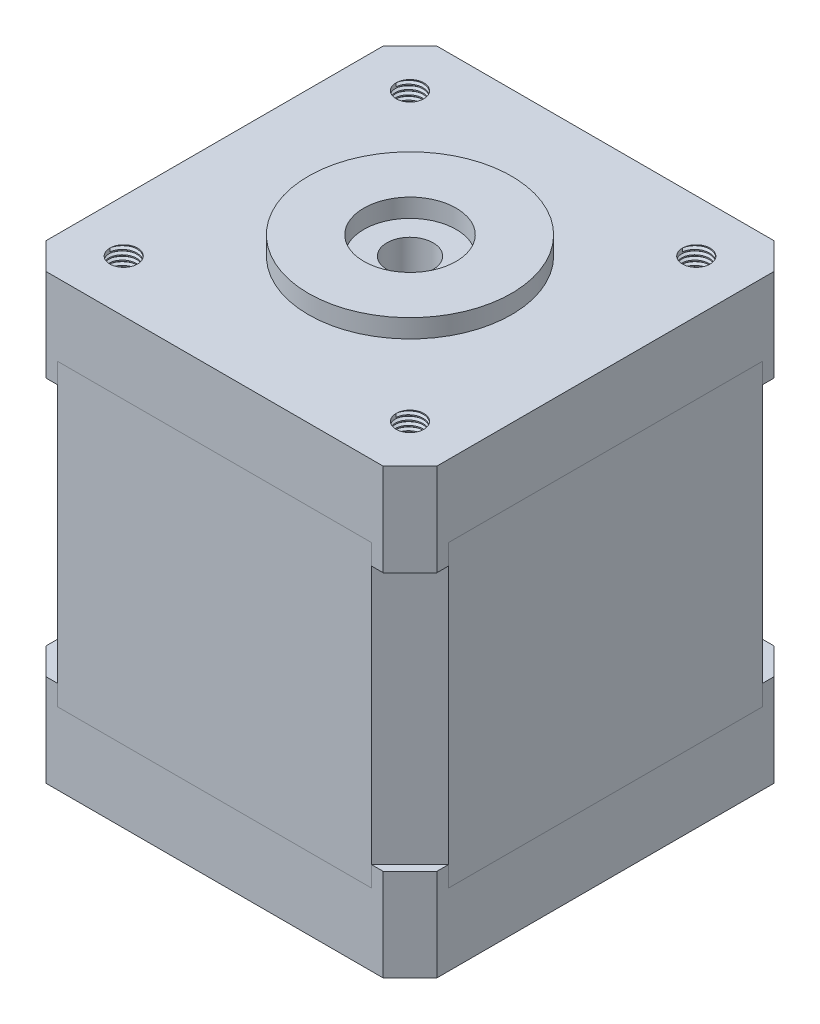
from build123d import *
from build123d.topology import SkipClean

# Parameters (mm, degrees)
BOSS_EXTRUDE1_DEPTH      = 10
CUT_EXTRUDE1_DEPTH       = 2.2
BOSS_EXTRUDE4_DEPTH      = 10
CUT_EXTRUDE2_DEPTH       = 2.2
BOSS_EXTRUDE5_DEPTH      = 30.2
BOSS_EXTRUDE5_DEPTH_BACK = 2.2
SKETCH8_R                = 10.9982
BOSS_EXTRUDE6_DEPTH      = 2
CUT_EXTRUDE3_START       = -50
SKETCH9_R                = 2.5
CUT_EXTRUDE3_DEPTH       = 50
SKETCH10_R               = 5
CUT_EXTRUDE4_DEPTH       = 2
SKETCH11_R               = 5
CUT_EXTRUDE5_DEPTH       = 2
SKETCH12_R               = 1.5
CUT_EXTRUDE6_DEPTH       = 4.5
THREAD1_PITCH            = 0.5
LPATTERN1_COUNT          = 2
LPATTERN1_PITCH          = 31
LPATTERN1_COUNT_DIR2     = 2
LPATTERN1_PITCH_DIR2     = 31
SKETCH13_R               = 1.5
CUT_EXTRUDE7_DEPTH       = 4.5
CHAMFER1_SIZE            = 0.5


with BuildPart() as part:
    # Sketch1 → Boss-Extrude1 (new body)
    with BuildSketch(Plane(origin=(0, 0, 0), x_dir=(1, 0, 0), z_dir=(0, 1, 0))):
        Polygon((-21.15, 18.25), (-18.25, 21.15), (18.25, 21.15), (21.15, 18.25), (21.15, -18.25), (18.25, -21.15), (-18.25, -21.15), (-21.15, -18.25), align=None)
    extrude(amount=BOSS_EXTRUDE1_DEPTH)

    # Sketch2 → Cut-Extrude1 (cut)
    with BuildSketch(Plane(origin=(0, 10, 0), x_dir=(1, 0, 0), z_dir=(0, 1, 0))):
        Polygon((-17, -21.15), (17, -21.15), (21.15, -17), (21.15, 17), (17, 21.15), (-17, 21.15), (-21.15, 17), (-21.15, -17), align=None)
    extrude(amount=-CUT_EXTRUDE1_DEPTH, mode=Mode.SUBTRACT)


with BuildPart() as body_2:
    # Sketch6 → Boss-Extrude4 (new body)
    with BuildSketch(Plane(origin=(0, 48, 0), x_dir=(-1, 0, 0), z_dir=(0, -1, 0))):
        Polygon((21.15, -18.25), (21.15, 18.25), (18.25, 21.15), (-18.25, 21.15), (-21.15, 18.25), (-21.15, -18.25), (-18.25, -21.15), (18.25, -21.15), align=None)
    extrude(amount=BOSS_EXTRUDE4_DEPTH)

    # Sketch7 → Cut-Extrude2 (cut)
    with BuildSketch(Plane.XZ.offset(-38)):
        Polygon((17, -21.15), (21.15, -17), (21.15, 17), (17, 21.15), (-17, 21.15), (-21.15, 17), (-21.15, -17), (-17, -21.15), align=None)
    extrude(amount=-CUT_EXTRUDE2_DEPTH, mode=Mode.SUBTRACT)

    # Sketch8 → Boss-Extrude6 (add)
    with BuildSketch(Plane(origin=(0, 48, 0), x_dir=(1, 0, 0), z_dir=(0, 1, 0))):
        with Locations(Location((0, 0, 0), (0, 0, 270))):
            Circle(SKETCH8_R)
    extrude(amount=BOSS_EXTRUDE6_DEPTH)


with BuildPart() as body_3:
    # Sketch2<2> → Boss-Extrude5 (new, two sides: drawn at the far end of the back side and taken through both)
    with BuildSketch(Plane(origin=(0, 10, 0), x_dir=(1, 0, 0), z_dir=(0, 1, 0)).offset(-BOSS_EXTRUDE5_DEPTH_BACK)):
        Polygon((-17, -21.15), (17, -21.15), (21.15, -17), (21.15, 17), (17, 21.15), (-17, 21.15), (-21.15, 17), (-21.15, -17), align=None)
    extrude(amount=BOSS_EXTRUDE5_DEPTH + BOSS_EXTRUDE5_DEPTH_BACK)


with BuildPart() as cut_extrude3_tool:
    # Sketch9 → Cut-Extrude3 (new body)
    with BuildSketch(Plane(origin=(0, 50, 0), x_dir=(1, 0, 0), z_dir=(0, 1, 0)).offset(CUT_EXTRUDE3_START)):
        with Locations(Location((0, 0, 0), (0, 0, 270))):
            Circle(SKETCH9_R)
    extrude(amount=CUT_EXTRUDE3_DEPTH)


with BuildPart() as part_1:
    add(part.part)

    # Cut-Extrude3: cut by cut_extrude3_tool
    add(cut_extrude3_tool.part, mode=Mode.SUBTRACT)

    # Sketch11 → Cut-Extrude5 (cut)
    with BuildSketch(Plane.XZ):
        with Locations(Location((0, 0, 0), (0, 0, 90))):
            Circle(SKETCH11_R)
    extrude(amount=-CUT_EXTRUDE5_DEPTH, mode=Mode.SUBTRACT)

    # Sketch13 → Cut-Extrude7 (cut)
    with BuildSketch(Plane.XZ):
        with Locations(Location((-15.5, 15.5, 0), (0, 0, 270))):
            Circle(SKETCH13_R)
        with Locations(Location((15.5, 15.5, 0), (0, 0, 270))):
            Circle(SKETCH13_R)
        with Locations(Location((15.5, -15.5, 0), (0, 0, 270))):
            Circle(SKETCH13_R)
        with Locations(Location((-15.5, -15.5, 0), (0, 0, 270))):
            Circle(SKETCH13_R)
    extrude(amount=-CUT_EXTRUDE7_DEPTH, mode=Mode.SUBTRACT)

    # Chamfer1
    chamfer1_edges = [part_1.edges().sort_by_distance(p)[0] for p in [
        (-15.5, 0, -14),
        (15.5, 0, -14),
        (15.5, 0, 17),
        (-15.5, 0, 17),
    ]]
    chamfer(chamfer1_edges, length=CHAMFER1_SIZE)


with BuildPart() as body_2_1:
    add(body_2.part)

    # Cut-Extrude3: cut by cut_extrude3_tool
    add(cut_extrude3_tool.part, mode=Mode.SUBTRACT)

    # Sketch10 → Cut-Extrude4 (cut)
    with BuildSketch(Plane(origin=(0, 50, 0), x_dir=(1, 0, 0), z_dir=(0, 1, 0))):
        with Locations(Location((0, 0, 0), (0, 0, 270))):
            Circle(SKETCH10_R)
    extrude(amount=-CUT_EXTRUDE4_DEPTH, mode=Mode.SUBTRACT)

    # Sketch12 → Cut-Extrude6 (cut)
    with BuildSketch(Plane(origin=(0, 48, 0), x_dir=(1, 0, 0), z_dir=(0, 1, 0))):
        with Locations(Location((-15.5, 15.5, 0), (0, 0, 270))):
            Circle(SKETCH12_R)
        with Locations(Location((15.5, 15.5, 0), (0, 0, 270))):
            Circle(SKETCH12_R)
        with Locations(Location((15.5, -15.5, 0), (0, 0, 270))):
            Circle(SKETCH12_R)
        with Locations(Location((-15.5, -15.5, 0), (0, 0, 270))):
            Circle(SKETCH12_R)
    extrude(amount=-CUT_EXTRUDE6_DEPTH, mode=Mode.SUBTRACT)

    # Thread1: the profile of Thread Profile1 profile screwed along a right-hand helix of 9 turns, 6 arcs to a turn; built about Z, then put on its axis
    with SkipClean():  # the faces are left unmerged after this step: merging them gives an invalid solid
        thread1_z = Axis((0, 0, 0), (0, 0, 1))
        thread1_corners = [(1.4997, 0, -0.000173205), (1.770632937, 0, 0.156249999), (1.770632937, 0, 0.218749999), (1.4997, 0, 0.375173204)]
        with BuildLine(mode=Mode.PRIVATE) as thread1_profile:
            Line(thread1_corners[0], thread1_corners[1])
            Line(thread1_corners[1], thread1_corners[2])
            Line(thread1_corners[2], thread1_corners[3])
            Line(thread1_corners[3], thread1_corners[0])
        thread1_cap = Face(thread1_profile.wire())
        thread1_turn_angles = [0, 30, 60, 90, 120, 150, 180, 210, 240, 270, 300, 330, 360]
        thread1_turn_weights = [1, 0.8660254037844387, 1, 0.8660254037844387, 1, 0.8660254037844387, 1, 0.8660254037844387, 1, 0.8660254037844387, 1, 0.8660254037844387, 1]
        thread1_turn_rails = [Edge.make_bspline([Vector(p[0], p[1], 0).rotate(thread1_z, thread1_turn_angles[k]) / thread1_turn_weights[k] + Vector(0, 0, p[2] + THREAD1_PITCH * thread1_turn_angles[k] / 360) for k in range(13)], [0, 0, 0, 1, 1, 2, 2, 3, 3, 4, 4, 5, 5, 6, 6, 6], 2, thread1_turn_weights) for p in thread1_corners]
        thread1_turn_sides = [Face.make_surface_from_curves(thread1_turn_rails[p[0]], thread1_turn_rails[p[1]]) for p in [(0, 1), (1, 2), (2, 3), (3, 0)]]
        thread1 = Plane(origin=(-15.5, 48, -15.5), x_dir=(-1, 0, 0), z_dir=(0, -1, 0)) * Solid(Shell([*[p.moved(Location((0, 0, THREAD1_PITCH * i))) for i in range(9) for p in thread1_turn_sides], thread1_cap, thread1_cap.rotate(thread1_z, 3240).moved(Location((0, 0, THREAD1_PITCH * 3240 / 360)))]))
        add(thread1, mode=Mode.SUBTRACT)

    # LPattern1: Thread1 2 × 2
    with SkipClean():  # the faces are left unmerged after this step: merging them gives an invalid solid
        with Locations(*[(i * LPATTERN1_PITCH, 0, j * LPATTERN1_PITCH_DIR2) for i in range(LPATTERN1_COUNT) for j in range(LPATTERN1_COUNT_DIR2) if (i, j) != (0, 0)]):
            add(thread1, mode=Mode.SUBTRACT)


with BuildPart() as body_3_1:
    add(body_3.part)

    # Cut-Extrude3: cut by cut_extrude3_tool
    add(cut_extrude3_tool.part, mode=Mode.SUBTRACT)


solid = Compound([part_1.part, body_2_1.part, body_3_1.part])
